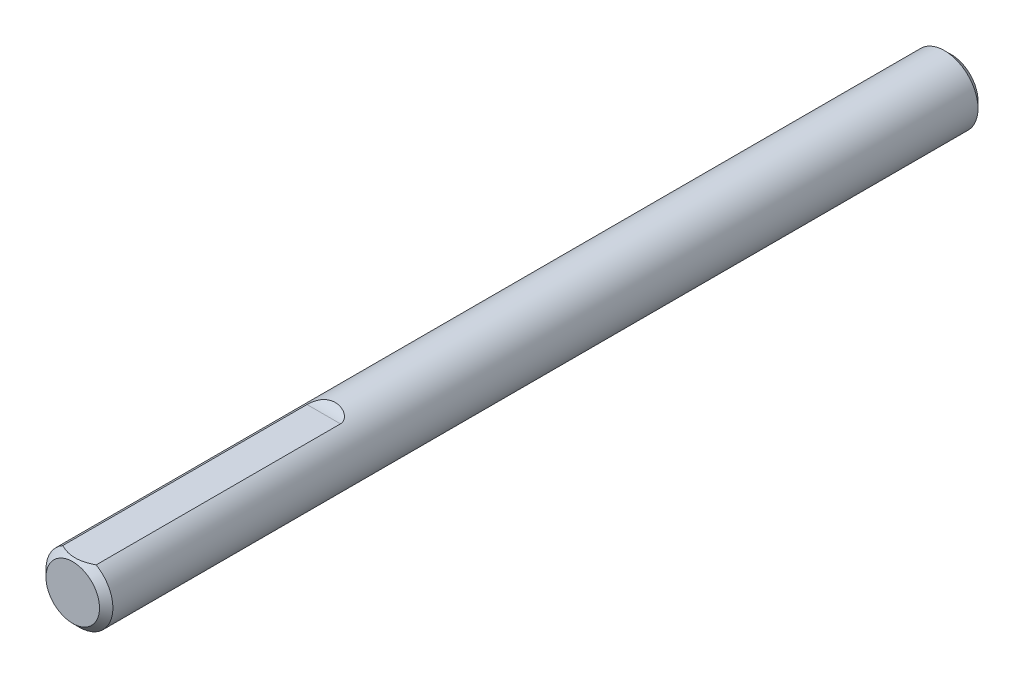
from build123d import *

# Parameters (mm, degrees)
SKETCH1_R      = 3.175
EXTRUDE1_DEPTH = 41.671875
CHAMFER1_SIZE  = 0.635
EXTRUDE7_DEPTH = 59.117462213
FILLET1_R      = 1.5875


with BuildPart() as part:
    # Sketch1 → Extrude1 (new, symmetric)
    with BuildSketch(Plane.XY):
        Circle(SKETCH1_R)
    extrude(amount=EXTRUDE1_DEPTH, both=True)

    # Chamfer1
    chamfer1_edges = [part.edges().sort_by_distance(p)[0] for p in [
        (-3.175, 0, -41.671875),
        (-3.175, 0, 41.671875),
    ]]
    chamfer(chamfer1_edges, length=CHAMFER1_SIZE)

    # Sketch13 → Extrude7 (cut, through all)
    with BuildSketch(Plane.XY.offset(16.271875)):
        with BuildLine():
            Line((-1.5875, 2.749630657), (1.5875, 2.749630657))
            ThreePointArc((1.5875, 2.749630657), (0, 3.175), (-1.5875, 2.749630657))
        make_face()
    extrude(amount=EXTRUDE7_DEPTH, mode=Mode.SUBTRACT)

    # Fillet1
    # the kernel refuses this fillet: 1.5875 mm, written as the material it adds along each edge
    with BuildSketch(Plane(origin=(-5.55625, 2.749630657, 16.271875), x_dir=(0, 0, 1), z_dir=(1, 0, 0))) as fillet1_piece_1_section:
        with BuildLine():
            CenterArc((FILLET1_R, -FILLET1_R), FILLET1_R, 90, 90)
            Line((0, -FILLET1_R), (0, 0))
            Line((0, 0), (FILLET1_R, 0))
        make_face()
    fillet1_piece_1 = extrude(amount=11.1125, mode=Mode.PRIVATE)
    fillet1_piece_1 = fillet1_piece_1 & Plane(origin=(0, 0, 16.798205884), x_dir=(1, 0, 0), z_dir=(0, 0, 1)) * Cylinder(3.175, 29, mode=Mode.PRIVATE)
    add(fillet1_piece_1)


solid = part.part
